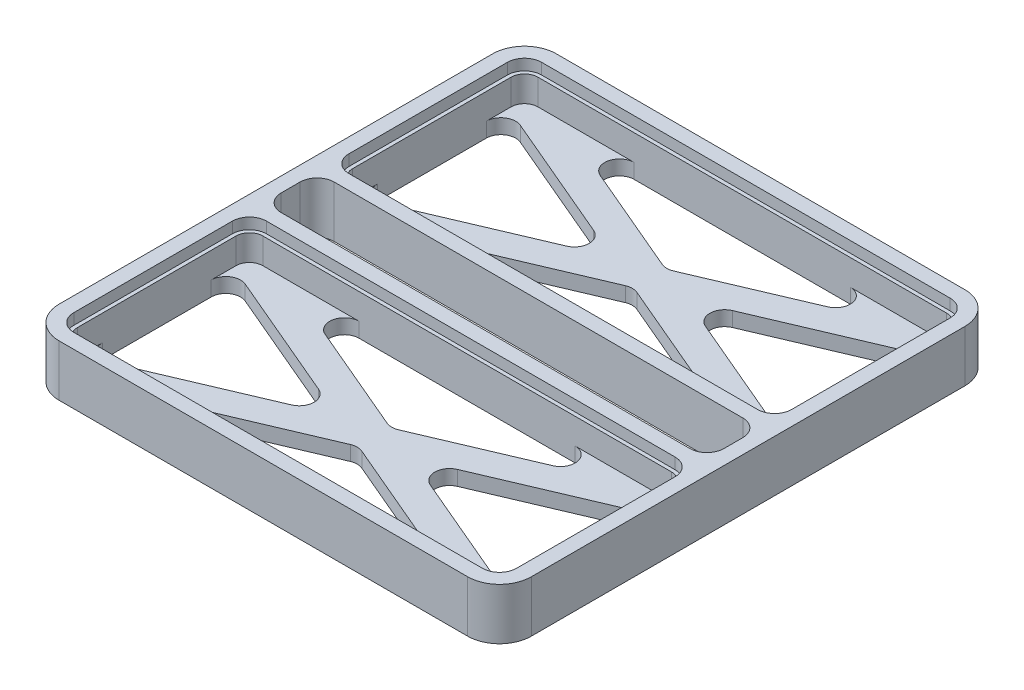
from build123d import *

# Parameters (mm, degrees)
EXTRUDE_1_DEPTH     = 2
EXTRUDE_1_2_DEPTH   = 2
EXTRUDE_2_DEPTH     = 7
SKETCH_2_W          = 60.2
SKETCH_2_H          = 26.2
EXTRUDE_3_DEPTH     = 5.5
SKETCH_4_R          = 0.5
CUT_EXTRUDE_1_DEPTH = 0.5


with BuildPart() as part:
    # Эскиз1 → Бобышка-Вытянуть1 (new body)
    with BuildSketch(Plane(origin=(0, 0, 0), x_dir=(1, 0, 0), z_dir=(0, 1, 0))):
        with BuildLine():
            Line((-32.1, -15.1), (32.1, -15.1))
            Line((32.1, -15.1), (32.1, 10.775))
            ThreePointArc((32.1, 10.775), (30.833236829, 13.833236829), (27.775, 15.1))
            Line((27.775, 15.1), (-27.775, 15.1))
            ThreePointArc((-27.775, 15.1), (-30.833236829, 13.833236829), (-32.1, 10.775))
            Line((-32.1, 10.775), (-32.1, -15.1))
        make_face()
        with BuildLine():
            Line((14.68883412, -12.6), (-14.68883412, -12.6))
            ThreePointArc((-14.68883412, -12.6), (-16.648480502, -10.999732483), (-15.472168434, -8.759786058))
            Line((-15.472168434, -8.759786058), (-0.783334313, -2.507106669))
            ThreePointArc((-0.783334313, -2.507106669), (0, -2.347320611), (0.783334313, -2.507106669))
            Line((0.783334313, -2.507106669), (15.472168434, -8.759786058))
            ThreePointArc((15.472168434, -8.759786058), (16.648480502, -10.999732483), (14.68883412, -12.6))
        make_face(mode=Mode.SUBTRACT)
        with BuildLine():
            Line((29.6, -7.401328038), (29.6, 7.401328038))
            ThreePointArc((29.6, 7.401328038), (28.703025696, 9.069660832), (26.816665687, 9.24154198))
            Line((26.816665687, 9.24154198), (9.429418868, 1.840213942))
            ThreePointArc((9.429418868, 1.840213942), (8.212753181, 0), (9.429418868, -1.840213942))
            Line((9.429418868, -1.840213942), (26.816665687, -9.24154198))
            ThreePointArc((26.816665687, -9.24154198), (28.703025696, -9.069660832), (29.6, -7.401328038))
        make_face(mode=Mode.SUBTRACT)
        with BuildLine():
            Line((14.68883412, 12.6), (-14.68883412, 12.6))
            ThreePointArc((-14.68883412, 12.6), (-16.648480502, 10.999732483), (-15.472168434, 8.759786058))
            Line((-15.472168434, 8.759786058), (-0.783334313, 2.507106669))
            ThreePointArc((-0.783334313, 2.507106669), (0, 2.347320611), (0.783334313, 2.507106669))
            Line((0.783334313, 2.507106669), (15.472168434, 8.759786058))
            ThreePointArc((15.472168434, 8.759786058), (16.648480502, 10.999732483), (14.68883412, 12.6))
        make_face(mode=Mode.SUBTRACT)
        with BuildLine():
            Line((-29.6, -7.401328038), (-29.6, 7.401328038))
            ThreePointArc((-29.6, 7.401328038), (-28.703025696, 9.069660832), (-26.816665687, 9.24154198))
            Line((-26.816665687, 9.24154198), (-9.429418868, 1.840213942))
            ThreePointArc((-9.429418868, 1.840213942), (-8.212753181, 0), (-9.429418868, -1.840213942))
            Line((-9.429418868, -1.840213942), (-26.816665687, -9.24154198))
            ThreePointArc((-26.816665687, -9.24154198), (-28.703025696, -9.069660832), (-29.6, -7.401328038))
        make_face(mode=Mode.SUBTRACT)
    extrude(amount=EXTRUDE_1_DEPTH)



with BuildPart() as body_2:
    # Эскиз1 → Extrude 1 2 (new body)
    with BuildSketch(Plane(origin=(0, 0, 0), x_dir=(1, 0, 0), z_dir=(0, 1, 0))):
        with BuildLine():
            Line((-27.775, -52.5), (27.775, -52.5))
            ThreePointArc((27.775, -52.5), (30.833236829, -51.233236829), (32.1, -48.175))
            Line((32.1, -48.175), (32.1, -22.3))
            Line((32.1, -22.3), (-32.1, -22.3))
            Line((-32.1, -22.3), (-32.1, -48.175))
            ThreePointArc((-32.1, -48.175), (-30.833236829, -51.233236829), (-27.775, -52.5))
        make_face()
        with BuildLine():
            Line((-0.783334313, -34.892893331), (-15.472168434, -28.640213942))
            ThreePointArc((-15.472168434, -28.640213942), (-16.648480502, -26.400267517), (-14.68883412, -24.8))
            Line((-14.68883412, -24.8), (14.68883412, -24.8))
            ThreePointArc((14.68883412, -24.8), (16.648480502, -26.400267517), (15.472168434, -28.640213942))
            Line((15.472168434, -28.640213942), (0.783334313, -34.892893331))
            ThreePointArc((0.783334313, -34.892893331), (0, -35.052679389), (-0.783334313, -34.892893331))
        make_face(mode=Mode.SUBTRACT)
        with BuildLine():
            Line((-9.429418868, -39.240213942), (-26.816665687, -46.64154198))
            ThreePointArc((-26.816665687, -46.64154198), (-28.703025696, -46.469660832), (-29.6, -44.801328038))
            Line((-29.6, -44.801328038), (-29.6, -29.998671962))
            ThreePointArc((-29.6, -29.998671962), (-28.703025696, -28.330339168), (-26.816665687, -28.15845802))
            Line((-26.816665687, -28.15845802), (-9.429418868, -35.559786058))
            ThreePointArc((-9.429418868, -35.559786058), (-8.212753181, -37.4), (-9.429418868, -39.240213942))
        make_face(mode=Mode.SUBTRACT)
        with BuildLine():
            Line((0.783334313, -39.907106669), (15.472168434, -46.159786058))
            ThreePointArc((15.472168434, -46.159786058), (16.648480502, -48.399732483), (14.68883412, -50))
            Line((14.68883412, -50), (-14.68883412, -50))
            ThreePointArc((-14.68883412, -50), (-16.648480502, -48.399732483), (-15.472168434, -46.159786058))
            Line((-15.472168434, -46.159786058), (-0.783334313, -39.907106669))
            ThreePointArc((-0.783334313, -39.907106669), (0, -39.747320611), (0.783334313, -39.907106669))
        make_face(mode=Mode.SUBTRACT)
        with BuildLine():
            Line((29.6, -44.801328038), (29.6, -29.998671962))
            ThreePointArc((29.6, -29.998671962), (28.703025696, -28.330339168), (26.816665687, -28.15845802))
            Line((26.816665687, -28.15845802), (9.429418868, -35.559786058))
            ThreePointArc((9.429418868, -35.559786058), (8.212753181, -37.4), (9.429418868, -39.240213942))
            Line((9.429418868, -39.240213942), (26.816665687, -46.64154198))
            ThreePointArc((26.816665687, -46.64154198), (28.703025696, -46.469660832), (29.6, -44.801328038))
        make_face(mode=Mode.SUBTRACT)
    extrude(amount=EXTRUDE_1_2_DEPTH)


with BuildPart() as part_1:
    add(part.part)

    add(body_2.part)  # Бобышка-Вытянуть2 merges body 2
    # Эскиз3 → Бобышка-Вытянуть2 (add)
    with BuildSketch(Plane(origin=(0, 0, 0), x_dir=(1, 0, 0), z_dir=(0, 1, 0))):
        with BuildLine():
            Line((-32.1, 10.775), (-32.1, -15.1))
            Line((-32.1, -15.1), (-32.1, -22.3))
            Line((-32.1, -22.3), (-32.1, -48.175))
            ThreePointArc((-32.1, -48.175), (-30.833236829, -51.233236829), (-27.775, -52.5))
            Line((-27.775, -52.5), (27.775, -52.5))
            ThreePointArc((27.775, -52.5), (30.833236829, -51.233236829), (32.1, -48.175))
            Line((32.1, -48.175), (32.1, -22.3))
            Line((32.1, -22.3), (32.1, -15.1))
            Line((32.1, -15.1), (32.1, 10.775))
            ThreePointArc((32.1, 10.775), (30.833236829, 13.833236829), (27.775, 15.1))
            Line((27.775, 15.1), (-27.775, 15.1))
            ThreePointArc((-27.775, 15.1), (-30.833236829, 13.833236829), (-32.1, 10.775))
        make_face()
        with BuildLine():
            ThreePointArc((-27.775, -50.5), (-29.419023266, -49.819023266), (-30.1, -48.175))
            Line((-30.1, -48.175), (-30.1, -26.625))
            ThreePointArc((-30.1, -26.625), (-29.419023266, -24.980976734), (-27.775, -24.3))
            Line((-27.775, -24.3), (27.775, -24.3))
            ThreePointArc((27.775, -24.3), (29.419023266, -24.980976734), (30.1, -26.625))
            Line((30.1, -26.625), (30.1, -48.175))
            ThreePointArc((30.1, -48.175), (29.419023266, -49.819023266), (27.775, -50.5))
            Line((27.775, -50.5), (-27.775, -50.5))
        make_face(mode=Mode.SUBTRACT)
        with BuildLine():
            Line((-30.1, -19.975), (-30.1, -17.425))
            ThreePointArc((-30.1, -17.425), (-29.419023266, -15.780976734), (-27.775, -15.1))
            Line((-27.775, -15.1), (27.775, -15.1))
            ThreePointArc((27.775, -15.1), (29.419023266, -15.780976734), (30.1, -17.425))
            Line((30.1, -17.425), (30.1, -19.975))
            ThreePointArc((30.1, -19.975), (29.419023266, -21.619023266), (27.775, -22.3))
            Line((27.775, -22.3), (-27.775, -22.3))
            ThreePointArc((-27.775, -22.3), (-29.419023266, -21.619023266), (-30.1, -19.975))
        make_face(mode=Mode.SUBTRACT)
        with BuildLine():
            Line((27.775, -13.1), (-27.775, -13.1))
            ThreePointArc((-27.775, -13.1), (-29.419023266, -12.419023266), (-30.1, -10.775))
            Line((-30.1, -10.775), (-30.1, 10.775))
            ThreePointArc((-30.1, 10.775), (-29.419023266, 12.419023266), (-27.775, 13.1))
            Line((-27.775, 13.1), (27.775, 13.1))
            ThreePointArc((27.775, 13.1), (29.419023266, 12.419023266), (30.1, 10.775))
            Line((30.1, 10.775), (30.1, -10.775))
            ThreePointArc((30.1, -10.775), (29.419023266, -12.419023266), (27.775, -13.1))
        make_face(mode=Mode.SUBTRACT)
    extrude(amount=EXTRUDE_2_DEPTH)

    # Эскиз2 → Бобышка-Вытянуть3 (add)
    # profile 1 of 2: a face of its own
    with BuildSketch(Plane(origin=(0, 0, 0), x_dir=(1, 0, 0), z_dir=(0, 1, 0))):
        Rectangle(SKETCH_2_W, SKETCH_2_H)
        with BuildLine():
            ThreePointArc((29.6, -10.775), (29.065469876, -12.065469876), (27.775, -12.6))
            Line((27.775, -12.6), (-27.775, -12.6))
            ThreePointArc((-27.775, -12.6), (-29.065469876, -12.065469876), (-29.6, -10.775))
            Line((-29.6, -10.775), (-29.6, 10.775))
            ThreePointArc((-29.6, 10.775), (-29.065469876, 12.065469876), (-27.775, 12.6))
            Line((-27.775, 12.6), (27.775, 12.6))
            ThreePointArc((27.775, 12.6), (29.065469876, 12.065469876), (29.6, 10.775))
            Line((29.6, 10.775), (29.6, -10.775))
        make_face(mode=Mode.SUBTRACT)
    # profile 2 of 2: a face of its own
    with BuildSketch(Plane(origin=(0, 0, 0), x_dir=(1, 0, 0), z_dir=(0, 1, 0))):
        with Locations((0, -37.4)):
            Rectangle(SKETCH_2_W, SKETCH_2_H)
        with BuildLine():
            Line((-27.775, -24.8), (27.775, -24.8))
            ThreePointArc((27.775, -24.8), (29.065469876, -25.334530124), (29.6, -26.625))
            Line((29.6, -26.625), (29.6, -48.175))
            ThreePointArc((29.6, -48.175), (29.065469876, -49.465469876), (27.775, -50))
            Line((27.775, -50), (-27.775, -50))
            ThreePointArc((-27.775, -50), (-29.065469876, -49.465469876), (-29.6, -48.175))
            Line((-29.6, -48.175), (-29.6, -26.625))
            ThreePointArc((-29.6, -26.625), (-29.065469876, -25.334530124), (-27.775, -24.8))
        make_face(mode=Mode.SUBTRACT)
    extrude(amount=EXTRUDE_3_DEPTH)

    # Эскиз4 → Вырез-Вытянуть1 (cut)
    with BuildSketch(Plane.XZ):
        with Locations((-30.85, 42.3)):
            Circle(SKETCH_4_R)
        with Locations((3.95, 37.4)):
            Circle(SKETCH_4_R)
        with Locations((31.3, 36.2)):
            Circle(SKETCH_4_R)
        with Locations((31.3, 1.2)):
            Circle(SKETCH_4_R)
        with Locations((3.95, 0)):
            Circle(SKETCH_4_R)
        with Locations((-30.85, -4.9)):
            Circle(SKETCH_4_R)
    extrude(amount=-CUT_EXTRUDE_1_DEPTH, mode=Mode.SUBTRACT)


solid = part_1.part
